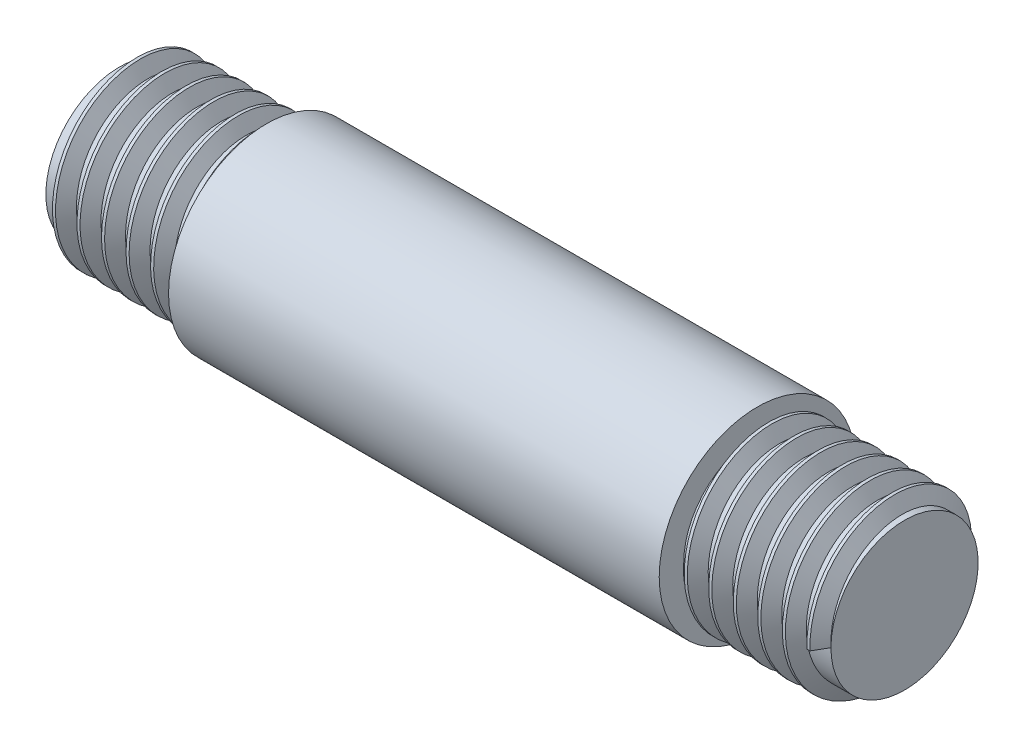
from build123d import *
from build123d.topology import SkipClean

# Parameters (mm, degrees)
THREAD1_PITCH = 0.5
THREAD2_PITCH = 0.5


with BuildPart() as part:
    # Sketch1 → Revolve1 (revolve)
    with BuildSketch(Plane.XY, mode=Mode.PRIVATE) as revolve1_sk:
        Polygon((8, 0), (-8, 0), (-8, 1.5), (-5, 1.5), (-5, 2), (5, 2), (5, 1.5), (8, 1.5), align=None)
    revolve(revolve1_sk.sketch.rotate(Axis((8, 0, 0), (-1, 0, 0)), 90), axis=Axis((8, 0, 0), (-1, 0, 0)))

    # Thread1: the profile of Thread Profile1 profile screwed along a right-hand helix of 6 turns, 6 arcs to a turn; built about Z, then put on its axis
    with SkipClean():  # the faces are left unmerged after this step: merging them gives an invalid solid
        thread1_z = Axis((0, 0, 0), (0, 0, 1))
        thread1_corners = [(1.4997, 0, -0.000173205), (1.770632938, 0, 0.156249999), (1.770632937, 0, 0.218749999), (1.4997, 0, 0.375173204)]
        with BuildLine(mode=Mode.PRIVATE) as thread1_profile:
            Line(thread1_corners[0], thread1_corners[1])
            Line(thread1_corners[1], thread1_corners[2])
            Line(thread1_corners[2], thread1_corners[3])
            Line(thread1_corners[3], thread1_corners[0])
        thread1_cap = Face(thread1_profile.wire())
        thread1_turn_angles = [0, 30, 60, 90, 120, 150, 180, 210, 240, 270, 300, 330, 360]
        thread1_turn_weights = [1, 0.8660254037844387, 1, 0.8660254037844387, 1, 0.8660254037844387, 1, 0.8660254037844387, 1, 0.8660254037844387, 1, 0.8660254037844387, 1]
        thread1_turn_rails = [Edge.make_bspline([Vector(p[0], p[1], 0).rotate(thread1_z, thread1_turn_angles[k]) / thread1_turn_weights[k] + Vector(0, 0, p[2] + THREAD1_PITCH * thread1_turn_angles[k] / 360) for k in range(13)], [0, 0, 0, 1, 1, 2, 2, 3, 3, 4, 4, 5, 5, 6, 6, 6], 2, thread1_turn_weights) for p in thread1_corners]
        thread1_turn_sides = [Face.make_surface_from_curves(thread1_turn_rails[p[0]], thread1_turn_rails[p[1]]) for p in [(0, 1), (1, 2), (2, 3), (3, 0)]]
        thread1 = Plane(origin=(8, 0, 0), x_dir=(0, 0, 1), z_dir=(-1, 0, 0)) * Solid(Shell([*[p.moved(Location((0, 0, THREAD1_PITCH * i))) for i in range(6) for p in thread1_turn_sides], thread1_cap, thread1_cap.rotate(thread1_z, 2160).moved(Location((0, 0, THREAD1_PITCH * 2160 / 360)))]))
        add(thread1)

    # Thread2: the profile of Thread Profile2 profile screwed along a right-hand helix of 6 turns, 6 arcs to a turn; built about Z, then put on its axis
    with SkipClean():  # the faces are left unmerged after this step: merging them gives an invalid solid
        thread2_z = Axis((0, 0, 0), (0, 0, 1))
        thread2_corners = [(1.4997, 0, -0.000173205), (1.770632938, 0, 0.156249999), (1.770632937, 0, 0.218749999), (1.4997, 0, 0.375173204)]
        with BuildLine(mode=Mode.PRIVATE) as thread2_profile:
            Line(thread2_corners[0], thread2_corners[1])
            Line(thread2_corners[1], thread2_corners[2])
            Line(thread2_corners[2], thread2_corners[3])
            Line(thread2_corners[3], thread2_corners[0])
        thread2_cap = Face(thread2_profile.wire())
        thread2_turn_angles = [0, 30, 60, 90, 120, 150, 180, 210, 240, 270, 300, 330, 360]
        thread2_turn_weights = [1, 0.8660254037844387, 1, 0.8660254037844387, 1, 0.8660254037844387, 1, 0.8660254037844387, 1, 0.8660254037844387, 1, 0.8660254037844387, 1]
        thread2_turn_rails = [Edge.make_bspline([Vector(p[0], p[1], 0).rotate(thread2_z, thread2_turn_angles[k]) / thread2_turn_weights[k] + Vector(0, 0, p[2] + THREAD2_PITCH * thread2_turn_angles[k] / 360) for k in range(13)], [0, 0, 0, 1, 1, 2, 2, 3, 3, 4, 4, 5, 5, 6, 6, 6], 2, thread2_turn_weights) for p in thread2_corners]
        thread2_turn_sides = [Face.make_surface_from_curves(thread2_turn_rails[p[0]], thread2_turn_rails[p[1]]) for p in [(0, 1), (1, 2), (2, 3), (3, 0)]]
        thread2 = Plane(origin=(-8, 0, 0), x_dir=(0, 0, -1), z_dir=(1, 0, 0)) * Solid(Shell([*[p.moved(Location((0, 0, THREAD2_PITCH * i))) for i in range(6) for p in thread2_turn_sides], thread2_cap, thread2_cap.rotate(thread2_z, 2160).moved(Location((0, 0, THREAD2_PITCH * 2160 / 360)))]))
        add(thread2)


solid = part.part
